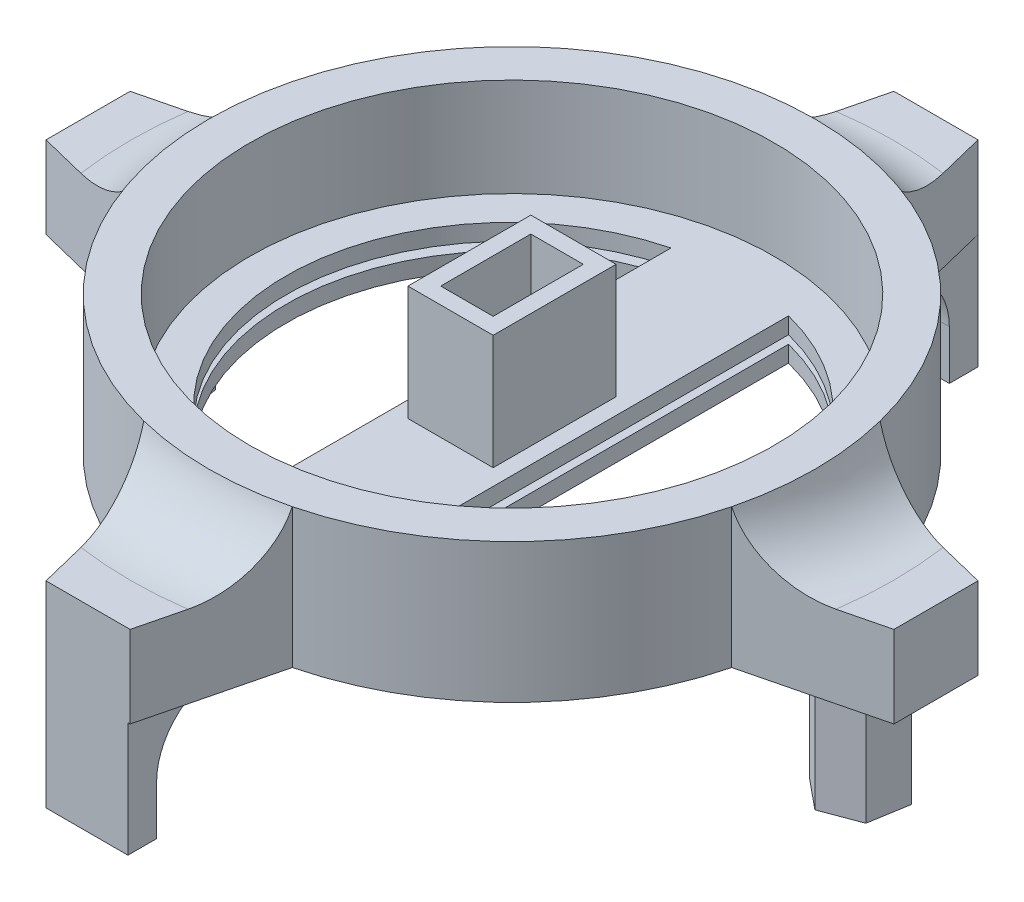
from build123d import *

# Parameters (mm, degrees)
SKETCH4_R                = 17
BOSS_EXTRUDE3_DEPTH      = 6
SHELL4_T                 = 0.5
SKETCH5_W                = 3.2
SKETCH5_H                = 5.5
BOSS_EXTRUDE4_DEPTH      = 8
SHELL5_T                 = 1
BOSS_EXTRUDE6_DEPTH      = 3.5
BOSS_EXTRUDE6_DEPTH_BACK = 1.5
SKETCH7_W                = 5
SKETCH7_H                = 1.75
BOSS_EXTRUDE7_DEPTH      = 7
FILLET3_R                = 5
CUT_EXTRUDE1_DEPTH       = 5
SKETCH13_W               = 3.166032567
SKETCH13_H               = 5.463514234
CUT_EXTRUDE2_DEPTH       = 5
FILLET4_R                = 4
BOSS_EXTRUDE8_DEPTH      = 7


with BuildPart() as part:
    # Sketch4 → Boss-Extrude3 (new body)
    with BuildSketch(Plane(origin=(0, 0, 0), x_dir=(1, 0, 0), z_dir=(0, 1, 0))):
        with Locations(Location((0, -46.79046007, 0), (0, 0, 270))):
            Circle(SKETCH4_R)
    extrude(amount=BOSS_EXTRUDE3_DEPTH)

    # Shell4
    shell4_openings = [part.faces().sort_by_distance(p)[0] for p in [
        (0, 6, 46.79046007),
    ]]
    offset(amount=SHELL4_T, openings=shell4_openings, kind=Kind.INTERSECTION)

    # Sketch5 → Boss-Extrude4 (add)
    with BuildSketch(Plane(origin=(0, 0, 0), x_dir=(1, 0, 0), z_dir=(0, 1, 0))):
        with Locations((0, -46.79046007)):
            Rectangle(SKETCH5_W, SKETCH5_H)
    extrude(amount=BOSS_EXTRUDE4_DEPTH)

    # Shell5
    shell5_openings = [part.faces().sort_by_distance(p)[0] for p in [
        (0, 8, 46.79046007),
    ]]
    offset(amount=SHELL5_T, openings=shell5_openings, kind=Kind.INTERSECTION)

    # Sketch6 → Boss-Extrude6 (add, two sides: drawn at the far end of the back side and taken through both)
    with BuildSketch(Plane(origin=(0, 0, 0), x_dir=(1, 0, 0), z_dir=(0, 1, 0)).offset(-BOSS_EXTRUDE6_DEPTH_BACK)):
        with BuildLine():
            Line((-2.565219646, -72.659781842), (2.565219646, -72.659781842))
            Line((2.565219646, -72.659781842), (4.531236217, -64.726956337))
            ThreePointArc((4.531236217, -64.726956337), (0, -65.29046007), (-4.531236217, -64.726956337))
            Line((-4.531236217, -64.726956337), (-2.565219646, -72.659781842))
        make_face()
        with BuildLine():
            Line((-25.869321772, -44.225240424), (-17.936496267, -42.259223853))
            ThreePointArc((-17.936496267, -42.259223853), (-18.5, -46.79046007), (-17.936496267, -51.321696288))
            Line((-17.936496267, -51.321696288), (-25.869321772, -49.355679717))
            Line((-25.869321772, -49.355679717), (-25.869321772, -44.225240424))
        make_face()
        with BuildLine():
            Line((2.565219646, -20.921138298), (4.531236217, -28.853963803))
            ThreePointArc((4.531236217, -28.853963803), (0, -28.29046007), (-4.531236217, -28.853963803))
            Line((-4.531236217, -28.853963803), (-2.565219646, -20.921138298))
            Line((-2.565219646, -20.921138298), (2.565219646, -20.921138298))
        make_face()
        with BuildLine():
            Line((25.869321772, -49.355679717), (17.936496267, -51.321696288))
            ThreePointArc((17.936496267, -51.321696288), (18.5, -46.79046007), (17.936496267, -42.259223853))
            Line((17.936496267, -42.259223853), (25.869321772, -44.225240424))
            Line((25.869321772, -44.225240424), (25.869321772, -49.355679717))
        make_face()
    extrude(amount=BOSS_EXTRUDE6_DEPTH + BOSS_EXTRUDE6_DEPTH_BACK)

    # Sketch7 → Boss-Extrude7 (add)
    with BuildSketch(Plane(origin=(0, -1.5, 0), x_dir=(-1, 0, 0), z_dir=(0, -1, 0))):
        with Locations((0.065219646, -71.784781842)):
            Rectangle(SKETCH7_W, SKETCH7_H)
        with Locations((-0.065219646, -21.796138298)):
            Rectangle(SKETCH7_W, SKETCH7_H)
    extrude(amount=BOSS_EXTRUDE7_DEPTH)

    # Fillet3
    # the kernel refuses this fillet: 5 mm, written as the material it adds along each edge
    with BuildSketch(Plane(origin=(0, 3.5, 46.79046007), x_dir=(-0.6278344871312538, 0, -0.7783468743231616), z_dir=(0.7783468743231616, 0, -0.6278344871312538))) as fillet3_piece_1_section:
        with BuildLine():
            CenterArc((23.269696007, 5), FILLET3_R, 197.457603124, 72.542396876)
            Line((23.269696007, 0), (23.269696007, -0.1))
            Line((23.269696007, -0.1), (18.5, -0.1))
            Line((18.5, -0.1), (18.4, 0))
            ThreePointArc((18.4, 0), (18.4, 1.75), (18.40460608, 3.47))
            Line((18.40460608, 3.47), (18.5, 3.5))
        make_face()
    fillet3_piece_1 = revolve(axis=Axis((0, 3.5, 46.79046007), (0, 1, 0)), revolution_arc=102.218929963, mode=Mode.PRIVATE)
    fillet3_piece_1 = split(fillet3_piece_1, bisect_by=Plane(origin=(-20.380505818, 4.426759582, 42.864930265), z_dir=(0.24055555302697984, 0, 0.9706353722731745)), keep=Keep.TOP, mode=Mode.PRIVATE)
    fillet3_piece_1 = split(fillet3_piece_1, bisect_by=Plane(origin=(-20.380505744, 4.426759582, 50.715989893), z_dir=(0.24055555302697348, 0, -0.9706353722731761)), keep=Keep.TOP, mode=Mode.PRIVATE)
    add(fillet3_piece_1)
    with BuildSketch(Plane(origin=(0, 3.5, 46.79046007), x_dir=(0.7783347748418207, 0, 0.6278494869568123), z_dir=(0.6278494869568123, 0, -0.7783347748418207))) as fillet3_piece_2_section:
        with BuildLine():
            CenterArc((23.269696007, -5), FILLET3_R, 90, 72.542396876)
            Line((23.269696007, 0), (23.269696007, 0.1))
            Line((23.269696007, 0.1), (18.5, 0.1))
            Line((18.5, 0.1), (18.4, 0))
            ThreePointArc((18.4, 0), (18.4, -1.75), (18.40460608, -3.47))
            Line((18.40460608, -3.47), (18.5, -3.5))
        make_face()
    fillet3_piece_2 = revolve(axis=Axis((0, 3.5, 46.79046007), (0, -1, 0)), revolution_arc=51.108360804, mode=Mode.PRIVATE)
    fillet3_piece_2 = split(fillet3_piece_2, bisect_by=Plane(origin=(4.048850537, 4.426759722, 66.673369956), z_dir=(-0.970635372273176, 0, -0.24055555302697343)), keep=Keep.TOP, mode=Mode.PRIVATE)
    add(fillet3_piece_2)
    with BuildSketch(Plane(origin=(0, 3.5, 46.79046007), x_dir=(0.7783468743230912, 0, -0.6278344871313409), z_dir=(0.6278344871313409, 0, 0.7783468743230912))) as fillet3_piece_3_section:
        with BuildLine():
            CenterArc((23.269696007, 5), FILLET3_R, 197.457603124, 72.542396876)
            Line((23.269696007, 0), (23.269696007, -0.1))
            Line((23.269696007, -0.1), (18.5, -0.1))
            Line((18.5, -0.1), (18.4, 0))
            ThreePointArc((18.4, 0), (18.4, 1.75), (18.40460608, 3.47))
            Line((18.40460608, 3.47), (18.5, 3.5))
        make_face()
    fillet3_piece_3 = revolve(axis=Axis((0, 3.5, 46.79046007), (0, 1, 0)), revolution_arc=102.218929963, mode=Mode.PRIVATE)
    fillet3_piece_3 = split(fillet3_piece_3, bisect_by=Plane(origin=(3.925529805, 4.426759582, 26.409954252), z_dir=(-0.9706353722731743, 0, 0.24055555302698087)), keep=Keep.TOP, mode=Mode.PRIVATE)
    fillet3_piece_3 = split(fillet3_piece_3, bisect_by=Plane(origin=(-3.925529823, 4.426759582, 26.409954326), z_dir=(0.9706353722731764, 0, 0.2405555530269717)), keep=Keep.TOP, mode=Mode.PRIVATE)
    add(fillet3_piece_3)
    with BuildSketch(Plane(origin=(0, 3.5, 46.79046007), x_dir=(0.6278344871312218, 0, 0.7783468743231875), z_dir=(-0.7783468743231875, 0, 0.6278344871312218))) as fillet3_piece_4_section:
        with BuildLine():
            CenterArc((23.269696007, 5), FILLET3_R, 197.457603124, 72.542396876)
            Line((23.269696007, 0), (23.269696007, -0.1))
            Line((23.269696007, -0.1), (18.5, -0.1))
            Line((18.5, -0.1), (18.4, 0))
            ThreePointArc((18.4, 0), (18.4, 1.75), (18.40460608, 3.47))
            Line((18.40460608, 3.47), (18.5, 3.5))
        make_face()
    fillet3_piece_4 = revolve(axis=Axis((0, 3.5, 46.79046007), (0, 1, 0)), revolution_arc=102.218929963, mode=Mode.PRIVATE)
    fillet3_piece_4 = split(fillet3_piece_4, bisect_by=Plane(origin=(20.380505818, 4.426759582, 50.715989875), z_dir=(-0.24055555302698112, 0, -0.9706353722731741)), keep=Keep.TOP, mode=Mode.PRIVATE)
    fillet3_piece_4 = split(fillet3_piece_4, bisect_by=Plane(origin=(20.380505744, 4.426759582, 42.864930247), z_dir=(-0.24055555302697304, 0, 0.9706353722731761)), keep=Keep.TOP, mode=Mode.PRIVATE)
    add(fillet3_piece_4)
    with BuildSketch(Plane(origin=(0, 3.5, 46.79046007), x_dir=(0, 0, 1), z_dir=(1, 0, 0))) as fillet3_piece_5_section:
        with BuildLine():
            CenterArc((23.269696007, -5), FILLET3_R, 90, 72.542396876)
            Line((23.269696007, 0), (23.269696007, 0.1))
            Line((23.269696007, 0.1), (18.5, 0.1))
            Line((18.5, 0.1), (18.4, 0))
            ThreePointArc((18.4, 0), (18.4, -1.75), (18.40460608, -3.47))
            Line((18.40460608, -3.47), (18.5, -3.5))
        make_face()
    fillet3_piece_5 = revolve(axis=Axis((0, 3.5, 46.79046007), (0, -1, 0)), revolution_arc=51.108360804, mode=Mode.PRIVATE)
    fillet3_piece_5 = split(fillet3_piece_5, bisect_by=Plane(origin=(-4.04885046, 4.426759578, 66.673370268), z_dir=(0.9706353722731745, 0, -0.24055555302697917)), keep=Keep.TOP, mode=Mode.PRIVATE)
    add(fillet3_piece_5)

    # Sketch11 → Cut-Extrude1 (cut)
    with BuildSketch(Plane(origin=(0, 1, 0), x_dir=(1, 0, 0), z_dir=(0, 1, 0))):
        with BuildLine():
            Line((-3.585868376, -59.921550203), (-3.585868376, -33.501237191))
            ThreePointArc((-3.585868376, -33.501237191), (-13.861572731, -46.711393697), (-3.585868376, -59.921550203))
        make_face()
        with BuildLine():
            Line((3.585868376, -59.921550203), (3.585868376, -33.501237191))
            ThreePointArc((3.585868376, -33.501237191), (13.861572731, -46.711393697), (3.585868376, -59.921550203))
        make_face()
    extrude(amount=-CUT_EXTRUDE1_DEPTH, mode=Mode.SUBTRACT)

    # Sketch13 → Cut-Extrude2 (cut)
    with BuildSketch(Plane(origin=(0, -0.5, 0), x_dir=(1, 0, 0), z_dir=(0, 1, 0))):
        with Locations((0.016983716, -46.772217187)):
            Rectangle(SKETCH13_W, SKETCH13_H)
    extrude(amount=-CUT_EXTRUDE2_DEPTH, mode=Mode.SUBTRACT)

    # Fillet4
    fillet4_edges = [part.edges().sort_by_distance(p)[0] for p in [
        (0.065219646, -1.5, 22.671138298),
        (-0.065219646, -1.5, 70.909781842),
    ]]
    fillet(fillet4_edges, radius=FILLET4_R)

    # Sketch16 → Boss-Extrude8 (add)
    with BuildSketch(Plane(origin=(0, -1.5, 0), x_dir=(-1, 0, 0), z_dir=(0, -1, 0))):
        Polygon((19.095115037, -47.769177252), (20.96203058, -49.305079029), (23.225618307, -48.456233631), (23.622290493, -46.071486456), (21.75537495, -44.535584679), (19.491787223, -45.384430077), align=None)
        Polygon((-19.525754656, -45.384430077), (-19.12908247, -47.769177252), (-20.995998013, -49.305079029), (-23.25958574, -48.456233631), (-23.656257926, -46.071486456), (-21.789342383, -44.535584679), align=None)
    extrude(amount=BOSS_EXTRUDE8_DEPTH)


solid = part.part
